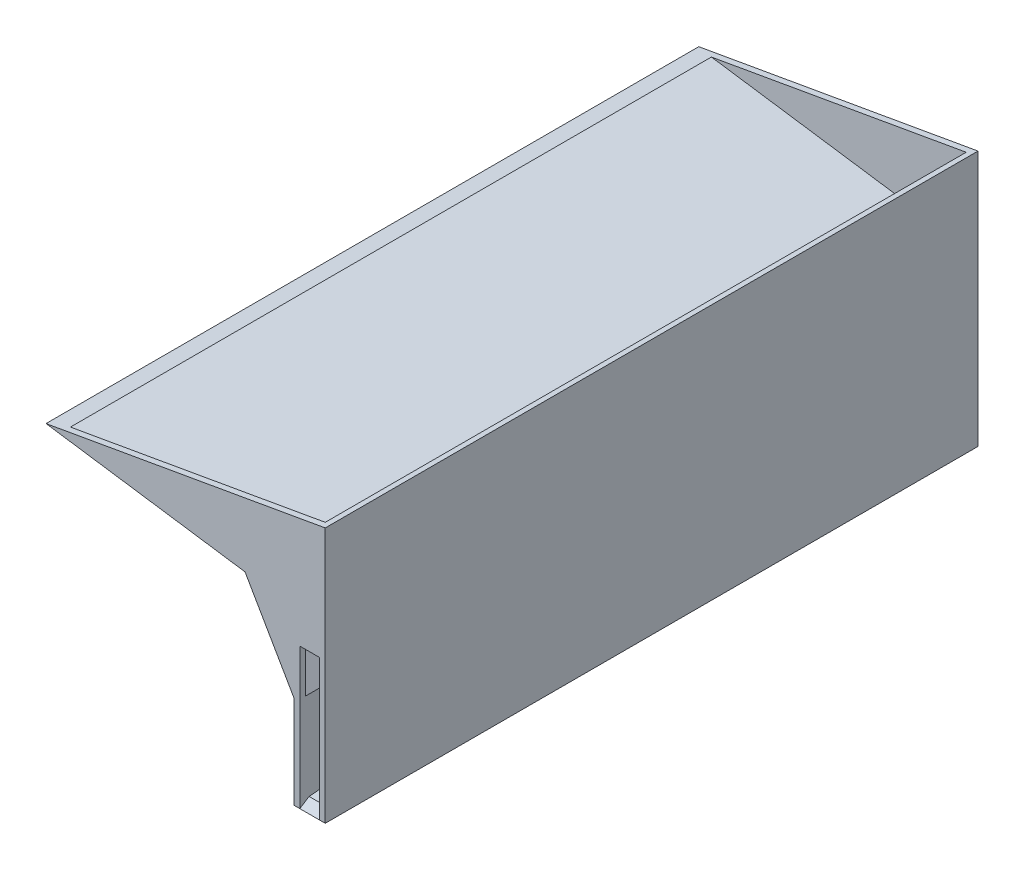
from build123d import *

# Parameters (mm, degrees)
BOSS_EXTRUDE1_DEPTH = 701.675
SHELL1_T            = -12.7
SKETCH3_W           = 42
SKETCH3_H           = 290
CUT_EXTRUDE1_DEPTH  = 20
BOSS_EXTRUDE2_REACH = 957.285
CHAMFER1_SIZE       = 12.7
CHAMFER1_SIZE_2     = 20


with BuildPart() as part:
    # Sketch2 → Boss-Extrude1 (new, symmetric)
    with BuildSketch(Plane.XY):
        Polygon((0, 0), (-105, 181.865334795), (-532.938806236, 244.144070894), (67.4, 350), (67.4, -200), (0, -200), align=None)
    extrude(amount=BOSS_EXTRUDE1_DEPTH, both=True)

    # Shell1
    shell1_openings = [part.faces().sort_by_distance(p)[0] for p in [
        (-232.769403118, 297.072035447, 0),
    ]]
    offset(amount=SHELL1_T, openings=shell1_openings, kind=Kind.INTERSECTION)

    # Sketch3 → Cut-Extrude1 (cut)
    with BuildSketch(Plane.XY.offset(701.675)):
        with Locations((33.7, -42.3)):
            Rectangle(SKETCH3_W, SKETCH3_H)
    extrude(amount=-CUT_EXTRUDE1_DEPTH, mode=Mode.SUBTRACT)

    # Sketch4 → Boss-Extrude2 (add, up to next)
    with BuildSketch(Plane(origin=(12.7, 0, 0), x_dir=(0, 0, -1), z_dir=(1, 0, 0)), mode=Mode.PRIVATE) as boss_extrude2_sk1:
        Polygon((688.975, -187.3), (688.975, -67.383663338), (-681.675, -187.3), align=None)
    boss_extrude2_tool1 = extrude(boss_extrude2_sk1.sketch, amount=BOSS_EXTRUDE2_REACH, mode=Mode.PRIVATE) - part.part
    add(boss_extrude2_tool1.solids().sort_by_distance((12.7, -147.327888, -232.091667))[0])

    # Chamfer1
    # the kernel refuses this chamfer: 20, 12.7 mm, written as the material it adds along each edge
    # the kernel refuses this chamfer: 20, 12.7 mm, written as the material it takes off along each edge
    with BuildSketch(Plane(origin=(12.7, -187.3, 701.675), x_dir=(0, -0.9986795899881412, 0.05137194313161755), z_dir=(1, 0, 0))) as chamfer1_2_piece_1:
        Polygon((CHAMFER1_SIZE * 0.998679589988, CHAMFER1_SIZE * 0.0513719431316), (-CHAMFER1_SIZE_2 * 0.0513719431316, CHAMFER1_SIZE_2 * 0.998679589988), (0, 0), align=None)
    extrude(amount=42, mode=Mode.SUBTRACT)


solid = part.part
